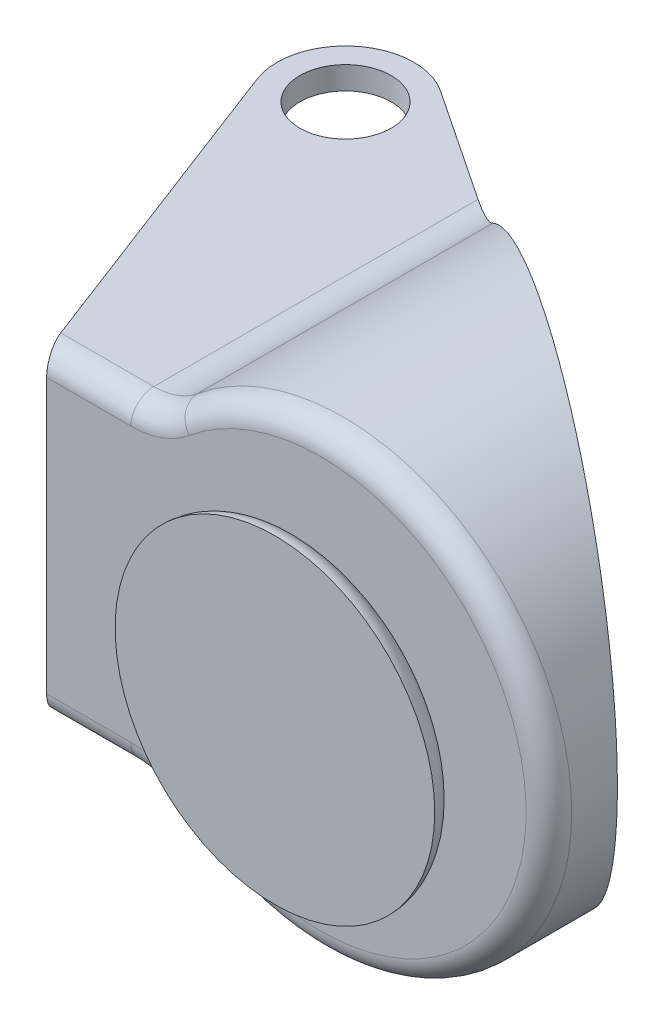
from build123d import *

# Parameters (mm, degrees)
SKETCH_1_R          = 10
EXTRUDE_1_DEPTH     = 14
CUT_EXTRUDE_1_DEPTH = 500
SKETCH_4_R          = 8
CUT_EXTRUDE_2_DEPTH = 1000
SKETCH_6_R          = 10
EXTRUDE_2_DEPTH     = 1
SKETCH_5_R          = 2.000000000000003
EXTRUDE_3_DEPTH     = 7
SKETCH_5_2_R        = 2.000000000000003
CUT_EXTRUDE_3_DEPTH = 6
SKETCH_7_W          = 0.9999999999999662
SKETCH_7_H          = 12
EXTRUDE_4_DEPTH     = 5
EXTRUDE_5_DEPTH     = 12
SKETCH_9_W          = 12.6666666666667
SKETCH_9_H          = 12
CUT_EXTRUDE_4_DEPTH = 5
SKETCH_10_R         = 4
EXTRUDE_6_DEPTH     = 2
SKETCH_11_R         = 7
EXTRUDE_7_DEPTH     = 1
FILLET_1_R          = 3
FILLET_2_R          = 1
FILLET_4_R          = 1


with BuildPart() as part:
    # 草图1 → 凸台-拉伸1 (new body)
    with BuildSketch(Plane.XY):
        Circle(SKETCH_1_R)
    extrude(amount=EXTRUDE_1_DEPTH)

    # 草图3 → 切除-拉伸1 (cut, symmetric)
    with BuildSketch(Plane(origin=(0, 0, 0), x_dir=(1, 0, 0), z_dir=(0, 1, 0))):
        Polygon((-7.999999999999998, 0), (10, 0), (10, -12), align=None)
    extrude(amount=CUT_EXTRUDE_1_DEPTH, both=True, mode=Mode.SUBTRACT)

    # 草图4 → 切除-拉伸2 (cut)
    with BuildSketch(Plane.XY.offset(14)):
        Circle(SKETCH_4_R)
    extrude(amount=-CUT_EXTRUDE_2_DEPTH, mode=Mode.SUBTRACT)

    # 草图6 → 凸台-拉伸2 (add)
    with BuildSketch(Plane.XY.offset(14)):
        Circle(SKETCH_6_R)
    extrude(amount=EXTRUDE_2_DEPTH)

    # 草图5 → 凸台-拉伸3 (add, symmetric)
    with BuildSketch(Plane(origin=(0, 0, 0), x_dir=(1, 0, 0), z_dir=(0, 1, 0))):
        with BuildLine():
            Line((-5.9999999999999964, -14.999999999999968), (-11.999999999999996, -14.999999999999968))
            Line((-11.999999999999996, -14.999999999999968), (-17.71032629227648, -0.0718206378086078))
            ThreePointArc((-17.71032629227648, -0.0718206378086078), (-16.78084089382489, 3.3438624943348247), (-13.244226324520296, 3.496150883013566))
            Line((-13.244226324520296, 3.496150883013566), (-5.999999999999997, -1.333333333333298))
            Line((-5.999999999999997, -1.333333333333298), (-5.9999999999999964, -14.999999999999968))
        make_face()
        with Locations(Location((-14.908326913195987, 1.0000000000000329, 0), (0, 0, 270))):
            Circle(SKETCH_5_R, mode=Mode.SUBTRACT)
    extrude(amount=EXTRUDE_3_DEPTH, both=True)

    # 草图5<2> → 切除-拉伸3 (cut, symmetric)
    with BuildSketch(Plane(origin=(0, 0, 0), x_dir=(1, 0, 0), z_dir=(0, 1, 0))):
        with BuildLine():
            Line((-5.9999999999999964, -14.999999999999968), (-11.999999999999996, -14.999999999999968))
            Line((-11.999999999999996, -14.999999999999968), (-17.71032629227648, -0.0718206378086078))
            ThreePointArc((-17.71032629227648, -0.0718206378086078), (-16.78084089382489, 3.3438624943348247), (-13.244226324520296, 3.496150883013566))
            Line((-13.244226324520296, 3.496150883013566), (-5.999999999999997, -1.333333333333298))
            Line((-5.999999999999997, -1.333333333333298), (-5.9999999999999964, -14.999999999999968))
        make_face()
        with Locations(Location((-14.908326913195987, 1.0000000000000329, 0), (0, 0, 270))):
            Circle(SKETCH_5_2_R, mode=Mode.SUBTRACT)
    extrude(amount=CUT_EXTRUDE_3_DEPTH, both=True, mode=Mode.SUBTRACT)

    # 草图7 → 凸台-拉伸4 (add)
    with BuildSketch(Plane.ZY.offset(5.999999999999997)):
        with Locations((14.499999999999986, 0)):
            Rectangle(SKETCH_7_W, SKETCH_7_H)
    extrude(amount=EXTRUDE_4_DEPTH)

    # 草图8 → 凸台-拉伸5 (add)
    with BuildSketch(Plane.XZ.offset(-6)):
        Polygon((-11.999999999999996, 14.999999999999968), (-12.382519941228653, 14), (-10.999999999999996, 14), (-10.999999999999996, 14.999999999999968), align=None)
    extrude(amount=EXTRUDE_5_DEPTH)

    # 草图9 → 切除-拉伸4 (cut)
    with BuildSketch(Plane.ZY.offset(5.999999999999997)):
        with Locations((7.6666666666666465, 0)):
            Rectangle(SKETCH_9_W, SKETCH_9_H)
    extrude(amount=-CUT_EXTRUDE_4_DEPTH, mode=Mode.SUBTRACT)

    # 草图10 → 凸台-拉伸6 (add)
    with BuildSketch(Plane.XY.offset(15)):
        Circle(SKETCH_10_R)
    extrude(amount=EXTRUDE_6_DEPTH)

    # 草图11 → 凸台-拉伸7 (add)
    with BuildSketch(Plane.XY.offset(17)):
        Circle(SKETCH_11_R)
    extrude(amount=-EXTRUDE_7_DEPTH)

    # 圆角1
    fillet_1_edges = [part.edges().sort_by_distance(p)[0] for p in [
        (-5.291502622129181, -6, 7.902832459290273),
        (-5.291502622129181, 6, 7.902832459290272),
        (-7.14142842854285, -7, 7.7861905238190845),
        (-7.14142842854285, 7, 7.786190523819085),
    ]]
    fillet(fillet_1_edges, radius=FILLET_1_R)

    # 圆角2
    fillet_2_edges = [part.edges().sort_by_distance(p)[0] for p in [
        (-7, 8.6e-16, 16),
    ]]
    fillet(fillet_2_edges, radius=FILLET_2_R - 0.0001)  # a hair under: the kernel refuses the full size

    # 圆角4
    fillet_4_edges = [part.edges().sort_by_distance(p)[0] for p in [
        (10, -1.78e-15, 15),
        (-7.287574532187941, -7.178380170622118, 14.999999999999968),
        (-7.287574532187943, 7.178380170622118, 14.999999999999968),
        (-10.153311931459037, 7, 14.999999999999968),
        (-10.153311931459037, -7, 14.999999999999968),
    ]]
    fillet(fillet_4_edges, radius=FILLET_4_R)


solid = part.part
